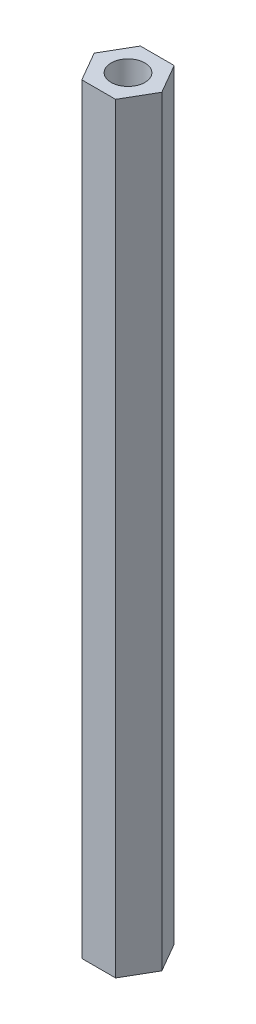
from build123d import *

# Parameters (mm, degrees)
SKETCH_1_R      = 2
EXTRUDE_1_DEPTH = 90


with BuildPart() as part:
    # 草图1 → 凸台-拉伸1 (new body)
    with BuildSketch(Plane(origin=(0, 0, 0), x_dir=(1, 0, 0), z_dir=(0, 1, 0))):
        Polygon((-1.90176803, 4.329567776), (-3.90176803, 0.865466161), (-1.90176803, -2.598635455), (2.09823197, -2.598635455), (4.09823197, 0.865466161), (2.09823197, 4.329567776), align=None)
        with Locations((0.09823197, 0.865466161)):
            Circle(SKETCH_1_R, mode=Mode.SUBTRACT)
    extrude(amount=EXTRUDE_1_DEPTH)


solid = part.part
